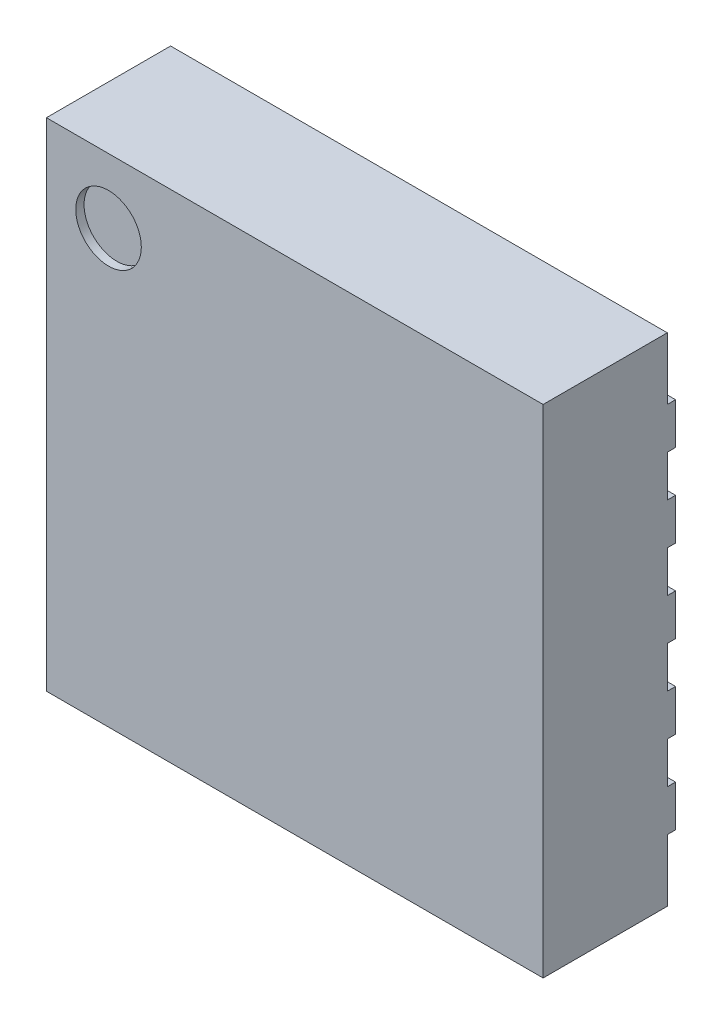
from build123d import *

# Parameters (mm, degrees)
SKETCH1_W           = 3
SKETCH1_H           = 3
BOSS_EXTRUDE1_DEPTH = 0.75
BOSS_EXTRUDE2_START = -0.05
BOSS_EXTRUDE2_DEPTH = 0.25
LPATTERN1_START     = -0.05
LPATTERN1_DEPTH     = 0.05
LPATTERN2_START     = -0.05
LPATTERN2_DEPTH     = 0.05
SKETCH3_R           = 0.197976387
CUT_EXTRUDE1_DEPTH  = 0.05
BOSS_EXTRUDE3_DEPTH = 0.05


with BuildPart() as part:
    # Sketch1 → Boss-Extrude1 (new body)
    with BuildSketch(Plane.XY):
        Rectangle(SKETCH1_W, SKETCH1_H)
    extrude(amount=BOSS_EXTRUDE1_DEPTH)

    # Sketch2 → Boss-Extrude2 (add)
    with BuildSketch(Plane.XY.offset(BOSS_EXTRUDE2_START)):
        with BuildLine():
            Line((-1.5, -0.125), (-1.225, -0.125))
            ThreePointArc((-1.225, -0.125), (-1.1, 0), (-1.225, 0.125))
            Line((-1.225, 0.125), (-1.5, 0.125))
            Line((-1.5, 0.125), (-1.5, -0.125))
        make_face()
    boss_extrude2 = extrude(amount=BOSS_EXTRUDE2_DEPTH)

    # LPattern1: read off the stored shape, not the designer's step
    # LPattern1 outline → LPattern1 (add)
    with BuildSketch(Plane.XY.offset(LPATTERN1_START)):
        with BuildLine():
            Line((-1.5, 0.375), (-1.225, 0.375))
            ThreePointArc((-1.225, 0.375), (-1.1, 0.5), (-1.225, 0.625))
            Line((-1.225, 0.625), (-1.5, 0.625))
            Line((-1.5, 0.625), (-1.5, 0.375))
        make_face()
        with BuildLine():
            Line((-1.5, 1.125), (-1.5, 0.875))
            Line((-1.5, 0.875), (-1.225, 0.875))
            ThreePointArc((-1.225, 0.875), (-1.1, 1), (-1.225, 1.125))
            Line((-1.225, 1.125), (-1.5, 1.125))
        make_face()
    lpattern1 = extrude(amount=LPATTERN1_DEPTH)

    # LPattern2: read off the stored shape, not the designer's step
    # LPattern2 outline → LPattern2 (add)
    with BuildSketch(Plane.XY.offset(LPATTERN2_START)):
        with BuildLine():
            Line((-1.5, -0.625), (-1.225, -0.625))
            ThreePointArc((-1.225, -0.625), (-1.1, -0.5), (-1.225, -0.375))
            Line((-1.225, -0.375), (-1.5, -0.375))
            Line((-1.5, -0.375), (-1.5, -0.625))
        make_face()
        with BuildLine():
            Line((-1.225, -0.875), (-1.5, -0.875))
            Line((-1.5, -0.875), (-1.5, -1.125))
            Line((-1.5, -1.125), (-1.225, -1.125))
            ThreePointArc((-1.225, -1.125), (-1.1, -1), (-1.225, -0.875))
        make_face()
    lpattern2 = extrude(amount=LPATTERN2_DEPTH)

    # Mirror1: Boss-Extrude2, LPattern1, LPattern2 across plane
    add(boss_extrude2.mirror(Plane(origin=(0, 0, 0), x_dir=(0, 0, 1), z_dir=(1, 0, 0))))
    add(lpattern1.mirror(Plane(origin=(0, 0, 0), x_dir=(0, 0, 1), z_dir=(1, 0, 0))))
    add(lpattern2.mirror(Plane(origin=(0, 0, 0), x_dir=(0, 0, 1), z_dir=(1, 0, 0))))

    # Sketch3 → Cut-Extrude1 (cut)
    with BuildSketch(Plane.XY.offset(0.75)):
        with Locations((-1.124834532, 1.109231375)):
            Circle(SKETCH3_R)
    extrude(amount=-CUT_EXTRUDE1_DEPTH, mode=Mode.SUBTRACT)

    # Sketch4 → Boss-Extrude3 (add)
    with BuildSketch(Plane.XY):
        Polygon((-0.625, 1.19), (-0.825, 0.99), (-0.825, -1.19), (0.825, -1.19), (0.825, 1.19), align=None)
    extrude(amount=-BOSS_EXTRUDE3_DEPTH)


solid = part.part
